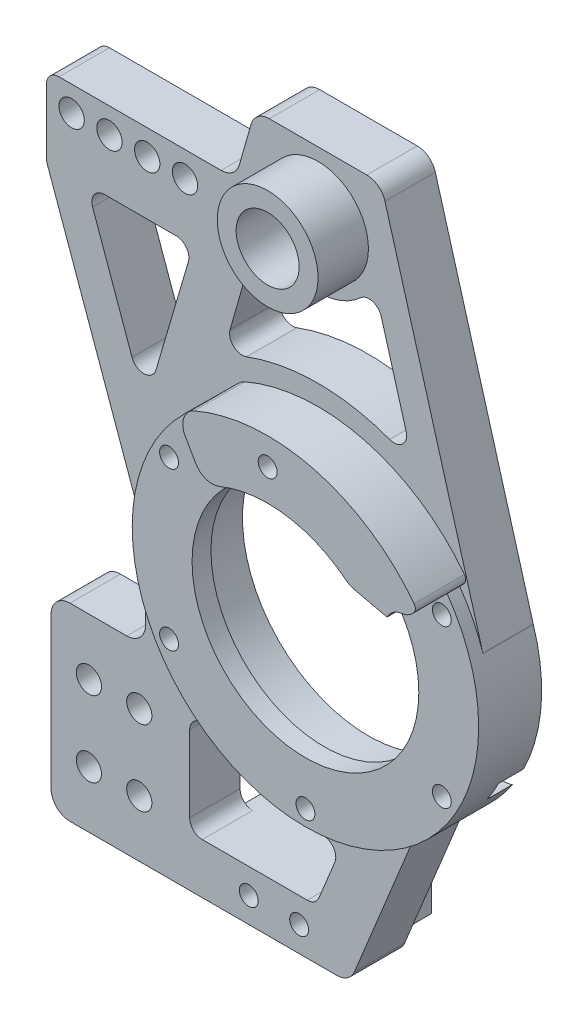
from build123d import *
from build123d.topology import SkipClean

# Parameters (mm, degrees)
SKETCH_1_R           = 27.5
SKETCH_1_R_2         = 20
SKETCH_1_R_3         = 1.5000000000000004
SKETCH_1_R_4         = 1.4999999999999996
SKETCH_1_R_5         = 1.5000000000000007
SKETCH_1_R_6         = 1.5000000000000002
EXTRUDE_1_DEPTH      = 8
EXTRUDE_START        = -8
SKETCH_2_R           = 4.999999999999999
EXTRUDE_2_DEPTH      = 8
EXTRUDE_3_DEPTH      = 8
SKETCH_6_R           = 2.0000000000000036
CUT_EXTRUDE_1_DEPTH  = 8
FILLET_1_R           = 2
EXTRUDE_5_DEPTH      = 8
FILLET_2_R           = 2
FILLET_3_R           = 3
SKETCH_8_R           = 2.009999999999999
SKETCH_8_R_2         = 2.010000000000004
CUT_EXTRUDE_2_DEPTH  = 8
SKETCH_9_R           = 1.5000000000000024
SKETCH_9_R_2         = 1.5000000000000022
CUT_EXTRUDE_3_DEPTH  = 8
EXTRUDE_START_2      = 8
SKETCH_14_R          = 8
SKETCH_14_R_2        = 5.000000000000004
EXTRUDE_7_DEPTH      = 8
SKETCH_15_R          = 1.5000000000000007
EXTRUDE_8_DEPTH      = 8
FILLET_4_R           = 3
FILLET_6_R           = 3
FILLET_9_R           = 1
FILLET_10_R          = 3
SKETCH_17_R          = 2.9999999999999996
SKETCH_17_R_2        = 2.999999999999998
SKETCH_17_R_3        = 3.0000000000000004
SKETCH_17_R_4        = 2.9999999999999982
SKETCH_17_R_5        = 2.999999999999999
CUT_EXTRUDE_6_DEPTH  = 12
CUT_EXTRUDE_7_DEPTH  = 8
FILLET_13_R          = 3
FILLET_14_R          = 1
SKETCH_19_R          = 8
SKETCH_19_R_2        = 5.0000000000000036
EXTRUDE_10_DEPTH     = 8
SKETCH_20_W          = 49.17006245268253
SKETCH_20_H          = 8.929503743070258
CUT_EXTRUDE_9_DEPTH  = 80.6256664475702
EXTRUDE_11_DEPTH     = 8
SKETCH_22_R          = 1.5000000000000002
SKETCH_22_R_2        = 1.4999999999999996
CUT_EXTRUDE_10_DEPTH = 115.11039231256969
SKETCH_23_R          = 1.5000000000000024
SKETCH_23_R_2        = 1.5000000000000036
CUT_EXTRUDE_11_DEPTH = 80.62566631178612
EXTRUDE_START_3      = -1
SKETCH_25_R          = 20
SKETCH_25_R_2        = 18.000000000000004
EXTRUDE_12_DEPTH     = 1
SKETCH_26_R          = 27.5
SKETCH_26_R_2        = 18.000000000000004
EXTRUDE_13_DEPTH     = 2
SKETCH_28_R          = 1.5000000000000002
SKETCH_28_R_2        = 1.4999999999999996
SKETCH_28_R_3        = 1.5000000000000007
SKETCH_28_R_4        = 1.5
SKETCH_28_R_5        = 1.4999999999999993
CUT_EXTRUDE_12_DEPTH = 10


with BuildPart() as part:
    # 草图1 → 凸台-拉伸1 (new body)
    with BuildSketch(Plane.XY):
        Circle(SKETCH_1_R)
        Circle(SKETCH_1_R_2, mode=Mode.SUBTRACT)
        with Locations((0, 25)):
            Circle(SKETCH_1_R_3, mode=Mode.SUBTRACT)
        with Locations((21.650635094610998, 12.49999999999995)):
            Circle(SKETCH_1_R_4, mode=Mode.SUBTRACT)
        with Locations((21.650635094610916, -12.500000000000105)):
            Circle(SKETCH_1_R_5, mode=Mode.SUBTRACT)
        with Locations((-1.7457e-13, -25)):
            Circle(SKETCH_1_R_6, mode=Mode.SUBTRACT)
        with Locations((-21.65063509461109, -12.499999999999801)):
            Circle(SKETCH_1_R_3, mode=Mode.SUBTRACT)
        with Locations((-21.65063509461082, 12.500000000000254)):
            Circle(SKETCH_1_R_4, mode=Mode.SUBTRACT)
    extrude(amount=EXTRUDE_1_DEPTH)

    # 草图2 → 凸台-拉伸2 (add)
    with BuildSketch(Plane.XY.offset(8).offset(EXTRUDE_START)):
        with BuildLine():
            ThreePointArc((-25.943936139173825, 9.119329888016473), (0.3603924360003816, 27.497638394816267), (26.174025002444875, 8.436255992523613))
            Line((26.17402500244488, 8.436255992523613), (10, 65))
            Line((10, 65), (-10, 65))
            Line((-10, 65), (-25.9439361391738, 9.119329888016466))
        make_face()
        with Locations((6.11e-15, 55)):
            Circle(SKETCH_2_R, mode=Mode.SUBTRACT)
        with BuildLine():
            ThreePointArc((-8.934964740604453, 50.509297929704616), (0.00579561060862899, 45.00000167945525), (8.940164009493113, 50.519657660025956))
            Line((8.940164009493113, 50.519657660025956), (15.166758498161308, 28.744033061810438))
            ThreePointArc((15.166758498161306, 28.744033061810434), (0.01443833162156238, 32.49999679283952), (-15.141213075085325, 28.757497572196108))
            Line((-15.141213075085329, 28.757497572196108), (-8.934964740604453, 50.509297929704616))
        make_face(mode=Mode.SUBTRACT)
    extrude(amount=EXTRUDE_2_DEPTH)

    # 草图4 → 凸台-拉伸3 (add)
    with BuildSketch(Plane.XY.offset(8).offset(EXTRUDE_START)):
        with BuildLine():
            ThreePointArc((15.000000000000005, -23.048861143232216), (-11.965613946200461, -24.76033285096331), (-27.379786827707274, -2.568515771667959))
            Line((-27.379786827707406, -2.568515771667964), (-27.379786827707402, -17.431484228333417))
            Line((-27.379786827707402, -17.431484228333417), (-42.3797868277074, -17.431484228333417))
            Line((-42.3797868277074, -17.431484228333417), (-42.37978682770739, -47.43148422833342))
            Line((-42.37978682770739, -47.43148422833342), (5, -47.43148422833342))
            Line((5.000000000000002, -47.43148422833342), (15.000000000000002, -23.04886114323222))
        make_face()
    extrude(amount=EXTRUDE_3_DEPTH)

    # 草图6 → 切除-拉伸1 (cut)
    with BuildSketch(Plane.XY.offset(8)):
        with BuildLine():
            Line((-20.379786827707523, -21.03923429485517), (-20.379786827707523, -39.431484228333424))
            Line((-20.379786827707523, -39.43148422833342), (-0.3656577887668905, -39.43148422833342))
            Line((-0.3656577887668906, -39.43148422833342), (3.9000445929543774, -29.030582891660615))
            ThreePointArc((3.9000445929543774, -29.030582891660618), (-9.1575591251104, -27.82308756638483), (-20.37978682770753, -21.039234294855163))
        make_face()
        with Locations((-28.379786827707523, -26.431484228333414)):
            Circle(SKETCH_6_R)
        with Locations((-36.37978682770753, -26.431484228333414)):
            Circle(SKETCH_6_R)
        with Locations((-36.3797868277074, -38.43148422833341)):
            Circle(SKETCH_6_R)
        with Locations((-28.3797868277074, -38.43148422833341)):
            Circle(SKETCH_6_R)
    extrude(amount=-CUT_EXTRUDE_1_DEPTH, mode=Mode.SUBTRACT)

    # 圆角1
    fillet_1_edges = [part.edges().sort_by_distance(p)[0] for p in [
        (-20.379786827707527, -21.039234294855166, 4),
        (3.900044592954378, -29.030582891660618, 4),
        (-0.36565778876689053, -39.43148422833342, 4),
        (-20.379786827707523, -39.43148422833342, 4),
    ]]
    fillet(fillet_1_edges, radius=FILLET_1_R)

    # 草图7 → 凸台-拉伸5 (add)
    with BuildSketch(Plane.XY.offset(8).offset(EXTRUDE_START)):
        with BuildLine():
            Line((-25.605980442528075, 10.303804702257906), (-13.118983471272958, 54.06851577166659))
            Line((-13.118983471272958, 54.06851577166659), (-43.118983471272955, 54.068515771666576))
            Line((-43.118983471272955, 54.068515771666576), (-43.118983471272955, 41.4999999999998))
            Line((-43.118983471272955, 41.4999999999998), (-27.379786827707406, -2.56851577166659))
            ThreePointArc((-27.379786827707278, -2.5685157716679656), (-27.2948033845881, 3.353163908412209), (-25.94393613917382, 9.119329888016479))
            Line((-25.9439361391738, 9.119329888016466), (-25.605980442528075, 10.303804702257906))
        make_face()
        Polygon((-19.824769918031997, 41.4999999999998), (-27.472571155541598, 15.530112253940402), (-36.74779095564553, 41.4999999999998), align=None, mode=Mode.SUBTRACT)
    extrude(amount=EXTRUDE_5_DEPTH)

    # 圆角2
    fillet_2_edges = [part.edges().sort_by_distance(p)[0] for p in [
        (-36.74779095564553, 41.4999999999998, 4),
        (-27.472571155541598, 15.530112253940402, 4),
        (-43.118983471272955, 41.4999999999998, 4),
        (-43.118983471272955, 54.068515771666576, 4),
        (-19.824769918031997, 41.4999999999998, 4),
        (15.166758498161306, 28.744033061810434, 4),
        (8.940164009493113, 50.519657660025956, 4),
        (-8.934964740604453, 50.509297929704616, 4),
        (-15.141213075085325, 28.757497572196108, 4),
    ]]
    fillet(fillet_2_edges, radius=FILLET_2_R)

    # 圆角3
    fillet_3_edges = [part.edges().sort_by_distance(p)[0] for p in [
        (-13.118983471272958, 54.06851577166659, 4),
        (26.174025002444875, 8.436255992523613, 4),
        (-10, 65, 4),
        (10, 65, 4),
        (15.000000000000004, -23.04886114323222, 4),
        (5.000000000000001, -47.43148422833342, 4),
        (-42.37978682770739, -47.43148422833342, 4),
        (-42.3797868277074, -17.431484228333417, 4),
        (-27.379786827707402, -17.431484228333417, 4),
        (-27.379786827707342, -2.568515771667963, 4),
    ]]
    fillet(fillet_3_edges, radius=FILLET_3_R)

    # 草图8 → 切除-拉伸2 (cut)
    with BuildSketch(Plane.XY.offset(8)):
        with Locations((-39.11898347127296, 50.06851577166658)):
            Circle(SKETCH_8_R)
        with Locations((-33.11898347127296, 50.06851577166658)):
            Circle(SKETCH_8_R)
        with Locations((-27.118983471272966, 50.06851577166658)):
            Circle(SKETCH_8_R_2)
        with Locations((-21.118983471272966, 50.06851577166658)):
            Circle(SKETCH_8_R)
    extrude(amount=-CUT_EXTRUDE_2_DEPTH, mode=Mode.SUBTRACT)

    # 草图9 → 切除-拉伸3 (cut)
    with BuildSketch(Plane.XY.offset(8)):
        with Locations((-10.999999999999996, -43.43148422833342)):
            Circle(SKETCH_9_R)
        with Locations((-2.9999999999999947, -43.43148422833342)):
            Circle(SKETCH_9_R_2)
    extrude(amount=-CUT_EXTRUDE_3_DEPTH, mode=Mode.SUBTRACT)

    # 草图14 → 凸台-拉伸7 (add)
    with BuildSketch(Plane(origin=(0, 0, 0), x_dir=(-1, 0, 0), z_dir=(0, 0, -1)).offset(EXTRUDE_START_2)):
        with Locations(Location((0, 55, 0), (0, 0, 180))):
            Circle(SKETCH_14_R)
        with Locations(Location((0, 55, 0), (0, 0, 180))):
            Circle(SKETCH_14_R_2, mode=Mode.SUBTRACT)
    extrude(amount=-EXTRUDE_7_DEPTH)

    # 草图15 → 凸台-拉伸8 (add)
    with SkipClean():  # the faces are left unmerged after this step: merging them gives an invalid solid
        with BuildSketch(Plane(origin=(0, 0, 0), x_dir=(-1, 0, 0), z_dir=(0, 0, -1)).offset(EXTRUDE_START_2)):
            with BuildLine():
                ThreePointArc((-13.007266130686366, 15.192466152850212), (-1.842024158780876, 19.914993020296734), (10.000000000000265, 17.320508075688622))
                Line((10.00000000000002, 17.32050807568876), (14.645691267883315, 25.36708138794168))
                ThreePointArc((14.645691267883036, 25.367081387941845), (-8.991224682055885, 27.877284114012973), (-26.707191449384325, 12.029589175967057))
                Line((-26.70719144938432, 12.029589175967057), (-13.007266130686364, 15.192466152850214))
            make_face()
            with Locations((0, 25)):
                Circle(SKETCH_15_R, mode=Mode.SUBTRACT)
        extrude(amount=-EXTRUDE_8_DEPTH)

    # 圆角4
    # the kernel refuses this fillet: 3 mm, written as the material it takes off along each edge
    with BuildSketch(Plane(origin=(-10.000000000000021, 17.320508075688764, -15.008771254956887), x_dir=(-0.5000000000000012, 0.8660254037844379, 0), z_dir=(0, 0, 1))) as fillet_4_piece_1:
        with BuildLine():
            CenterArc((2.803508501982758, -3), FILLET_4_R, 90, 82.50528254607332)
            ThreePointArc((-0.17086217218890562, -2.6086956521739126), (-0.04276125617296566, -1.3071425790207607), (0, 0))
            Line((0, 0), (2.8035085019827584, 1.4e-16))
        make_face()
    extrude(amount=15.008771254956887, mode=Mode.SUBTRACT)

    # 圆角6
    fillet_6_edges = [part.edges().sort_by_distance(p)[0] for p in [
        (-14.645691267883176, 25.367081387941763, -4),
    ]]
    fillet(fillet_6_edges, radius=FILLET_6_R)

    # 圆角9
    # the kernel refuses this fillet: 1 mm, written as the material it takes off along each edge
    with BuildSketch(Plane(origin=(26.70719144938433, 12.029589175967054, -13.373228593487674), x_dir=(-0.44386184302665843, 0.896095231716461, 0), z_dir=(0, 0, 1))) as fillet_9_piece_1:
        with BuildLine():
            CenterArc((2.112603318717673, 0.999326764350836), FILLET_9_R, 140.6494572188422, 131.45308899718444)
            Line((1.3393221393082273, 1.633390024263549), (0, 0))
            ThreePointArc((0, 0), (1.0746457186975409, -0.01972000293635641), (2.149291437395081, 4e-17))
        make_face()
    extrude(amount=13.373228593487674, mode=Mode.SUBTRACT)

    # 圆角10
    fillet_10_edges = [part.edges().sort_by_distance(p)[0] for p in [
        (13.007266130686366, 15.192466152850212, -4),
    ]]
    fillet(fillet_10_edges, radius=FILLET_10_R)

    # 草图17 → 切除-拉伸6 (cut)
    with BuildSketch(Plane(origin=(0, 0, -8), x_dir=(-1, 0, 0), z_dir=(0, 0, -1))):
        with Locations((0, 25)):
            Circle(SKETCH_17_R)
        with Locations((21.650635094610998, 12.49999999999995)):
            Circle(SKETCH_17_R_2)
        with Locations((21.650635094610916, -12.500000000000105)):
            Circle(SKETCH_17_R_3)
        with Locations((-1.7457e-13, -25)):
            Circle(SKETCH_17_R)
        with Locations((-21.65063509461109, -12.499999999999801)):
            Circle(SKETCH_17_R_4)
        with Locations((-21.65063509461082, 12.500000000000254)):
            Circle(SKETCH_17_R_5)
    extrude(amount=-CUT_EXTRUDE_6_DEPTH, mode=Mode.SUBTRACT)

    # 草图18 → 切除-拉伸7 (cut)
    with BuildSketch(Plane(origin=(0, 0, -8), x_dir=(-1, 0, 0), z_dir=(0, 0, -1))):
        with BuildLine():
            Line((-23.641270067668014, 17.293797744977688), (-28.493207902164144, 13.940184731791717))
            Line((-28.493207902164144, 13.940184731791717), (-24.910514504724148, 10.325925753757534))
            Line((-24.910514504724148, 10.325925753757534), (-23.875029741649886, 12.789125027835365))
            ThreePointArc((-23.875029741649886, 12.789125027835365), (-23.86467485561845, 15.046989254771407), (-23.641270067668014, 17.293797744977688))
        make_face()
    extrude(amount=-CUT_EXTRUDE_7_DEPTH, mode=Mode.SUBTRACT)

    # 圆角13
    # the kernel refuses this fillet: 3 mm, written as the material it takes off along each edge
    with BuildSketch(Plane(origin=(23.886783347866572, 14.499910245351591, 0), x_dir=(-0.9374558215707414, 0.34810426972837655, 0), z_dir=(0, 0, -1))) as fillet_13_piece_1:
        with BuildLine():
            CenterArc((4.200338707288567, 2.6532402568275613), FILLET_13_R, 182.28400165957783, 59.895420995337645)
            Line((1.2027220215556462, 2.5336818802260708), (1.1427696878409872, 2.531290712694039))
            ThreePointArc((1.1427696878409872, 2.531290712694039), (0.5099550648750645, 1.3102307377416786), (-0.05561957677165612, 0.02250472572021236))
            Line((-0.05561957677165612, 0.02250472572021236), (0.02800225804859122, -0.05306480513655184))
            ThreePointArc((0.02800225804859122, -0.05306480513655184), (1.4001129024295225, 0.28675974317244), (2.7722235468104546, -0.05306480513655148))
            Line((2.7722235468104546, -0.05306480513655148), (2.800225804859045, 1e-17))
        make_face()
    extrude(amount=15.011635031913391, mode=Mode.SUBTRACT)

    # 圆角14
    fillet_14_edges = [part.edges().sort_by_distance(p)[0] for p in [
        (23.641270067668014, 17.293797744977688, -4),
    ]]
    fillet(fillet_14_edges, radius=FILLET_14_R)

    # 草图19 → 凸台-拉伸10 (add)
    # profile 1 of 2: a face of its own
    with BuildSketch(Plane.XY.offset(8)):
        with Locations((0, 55)):
            Circle(SKETCH_19_R)
        with Locations((0, 55)):
            Circle(SKETCH_19_R_2, mode=Mode.SUBTRACT)
    # profile 2 of 2: a face of its own
    with BuildSketch(Plane.XY.offset(8)):
        with BuildLine():
            Line((13.697964906701117, 15.033005775819044), (18.956177372854704, 13.81905177520426))
            ThreePointArc((18.956177372854704, 13.81905177520426), (19.900746003665365, 14.936778235578963), (21.26169536538885, 15.474680804226606))
            ThreePointArc((21.26169536538885, 15.474680804226606), (22.36017683797403, 15.844063512569386), (23.23668463857468, 16.602245025349646))
            ThreePointArc((23.23668463857468, 16.602245025349646), (23.448698192397256, 17.213453445010128), (23.242190499098495, 17.82654401896863))
            ThreePointArc((23.242190499098495, 17.82654401896863), (7.349858824703768, 28.354270685622204), (-11.65550255308797, 26.872557583742758))
            ThreePointArc((-11.65550255308797, 26.872557583742758), (-13.310425612282504, 25.06107723096147), (-13.059831503909368, 22.620291703059625))
            Line((-13.059831503909368, 22.620291703059625), (-11.401754250991402, 19.74841765813149))
            ThreePointArc((-11.401754250991402, 19.74841765813149), (-9.767865477179877, 18.40758281863684), (-7.655372208380949, 18.476884920114337))
            ThreePointArc((-7.655372208380949, 18.476884920114337), (2.8128308191684352, 19.801211649359647), (12.498102669332805, 15.614013887108474))
            ThreePointArc((12.498102669332805, 15.614013887108474), (13.065351981738239, 15.256017374059338), (13.697964906701117, 15.033005775819044))
        make_face()
    extrude(amount=EXTRUDE_10_DEPTH)

    # 草图20 → 切除-拉伸9 (cut, through all)
    with BuildSketch(Plane(origin=(0, 0, 0), x_dir=(1, 0, 0), z_dir=(0, 1, 0))):
        with Locations((5.2284355189061404, 4.464751871535129)):
            Rectangle(SKETCH_20_W, SKETCH_20_H)
    extrude(amount=CUT_EXTRUDE_9_DEPTH, mode=Mode.SUBTRACT)

    # 草图21 → 凸台-拉伸11 (add)
    with BuildSketch(Plane(origin=(0, 0, 0), x_dir=(-1, 0, 0), z_dir=(0, 0, -1))):
        Polygon((19.999999999999993, -39.43148422833342), (-2.000000000000006, -39.43148422833341), (-2.000000000000009, -47.43148422833342), (19.999999999999993, -47.43148422833342), align=None)
    extrude(amount=EXTRUDE_11_DEPTH)

    # 草图22 → 切除-拉伸10 (cut, through all)
    with BuildSketch(Plane(origin=(1.367e-14, -39.43148422833342, 0), x_dir=(1, 3.5e-16, 0), z_dir=(-3.5e-16, 1, 0))):
        with Locations(Location((-15.000000000000007, 4, 0), (0, 0, 180))):
            Circle(SKETCH_22_R)
        with Locations(Location((-7.000000000000006, 4, 0), (0, 0, 180))):
            Circle(SKETCH_22_R_2)
    extrude(amount=-CUT_EXTRUDE_10_DEPTH, mode=Mode.SUBTRACT)

    # 草图23 → 切除-拉伸11 (cut, through all)
    with BuildSketch(Plane.XY):
        with Locations((-10.999999999999996, -43.43148422833342)):
            Circle(SKETCH_23_R)
        with Locations((-2.9999999999999947, -43.43148422833342)):
            Circle(SKETCH_23_R_2)
    extrude(amount=-CUT_EXTRUDE_11_DEPTH, mode=Mode.SUBTRACT)

    # 草图25 → 凸台-拉伸12 (add)
    with BuildSketch(Plane.XY.offset(8).offset(EXTRUDE_START_3)):
        Circle(SKETCH_25_R)
        Circle(SKETCH_25_R_2, mode=Mode.SUBTRACT)
    extrude(amount=EXTRUDE_12_DEPTH)

    # 草图26 → 凸台-拉伸13 (add)
    # profile 1 of 2: a face of its own
    with BuildSketch(Plane.XY.offset(8)):
        with BuildLine():
            Line((-12.572707277227936, 26.25192997406383), (-19.350393192825646, 19.54001748420525))
            ThreePointArc((-19.35039319282565, 19.54001748420525), (-16.55411083842956, 21.95931270210862), (-13.458548014285139, 23.98160723027507))
            ThreePointArc((-13.458548014285142, 23.981607230275067), (-13.256546042627143, 25.210770801124802), (-12.572707277227938, 26.25192997406383))
        make_face()
    # profile 2 of 2: a face of its own
    with BuildSketch(Plane.XY.offset(8)):
        Circle(SKETCH_26_R)
        Circle(SKETCH_26_R_2, mode=Mode.SUBTRACT)
    extrude(amount=EXTRUDE_13_DEPTH)

    # 草图28 → 切除-拉伸12 (cut)
    with BuildSketch(Plane(origin=(0, 0, 8), x_dir=(-1, 0, 0), z_dir=(0, 0, -1))):
        with Locations((0, 25)):
            Circle(SKETCH_28_R)
        with Locations((21.650635094610998, 12.49999999999995)):
            Circle(SKETCH_28_R_2)
        with Locations((21.650635094610916, -12.500000000000105)):
            Circle(SKETCH_28_R_3)
        with Locations((-1.7457e-13, -25)):
            Circle(SKETCH_28_R_4)
        with Locations((-21.65063509461109, -12.499999999999801)):
            Circle(SKETCH_28_R_5)
        with Locations((-21.65063509461082, 12.500000000000254)):
            Circle(SKETCH_28_R_2)
    extrude(amount=-CUT_EXTRUDE_12_DEPTH, mode=Mode.SUBTRACT)


solid = part.part
